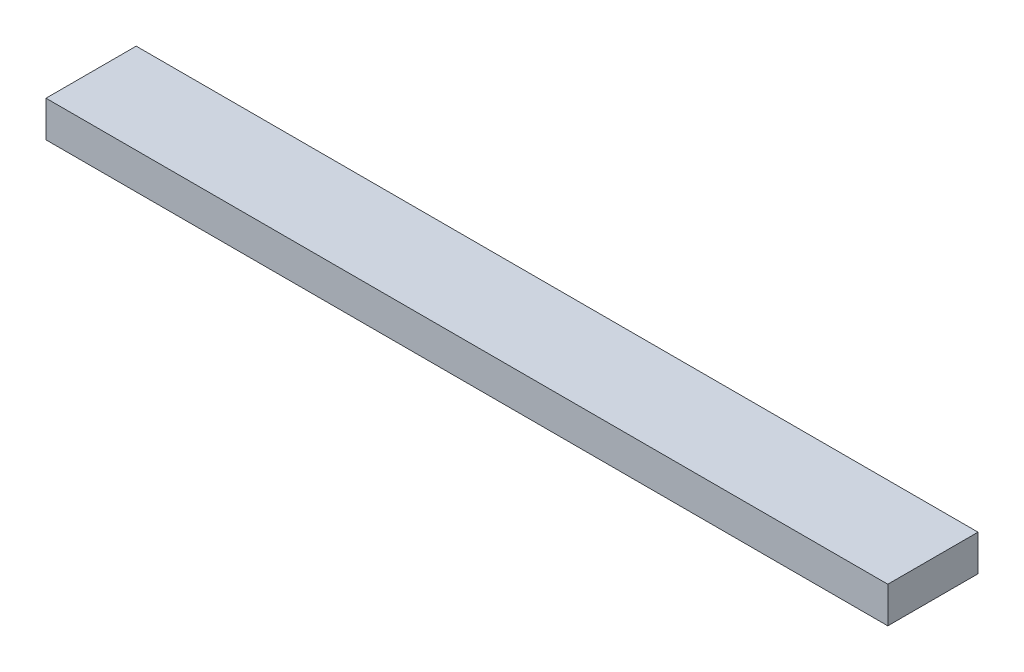
from build123d import *

# Parameters (mm, degrees)
SKETCH1_W           = 140
SKETCH1_H           = 15
BOSS_EXTRUDE1_DEPTH = 6


with BuildPart() as part:
    # Sketch1 → Boss-Extrude1 (new body)
    with BuildSketch(Plane(origin=(0, 0, 0), x_dir=(1, 0, 0), z_dir=(0, 1, 0))):
        Rectangle(SKETCH1_W, SKETCH1_H)
    extrude(amount=BOSS_EXTRUDE1_DEPTH)


solid = part.part
